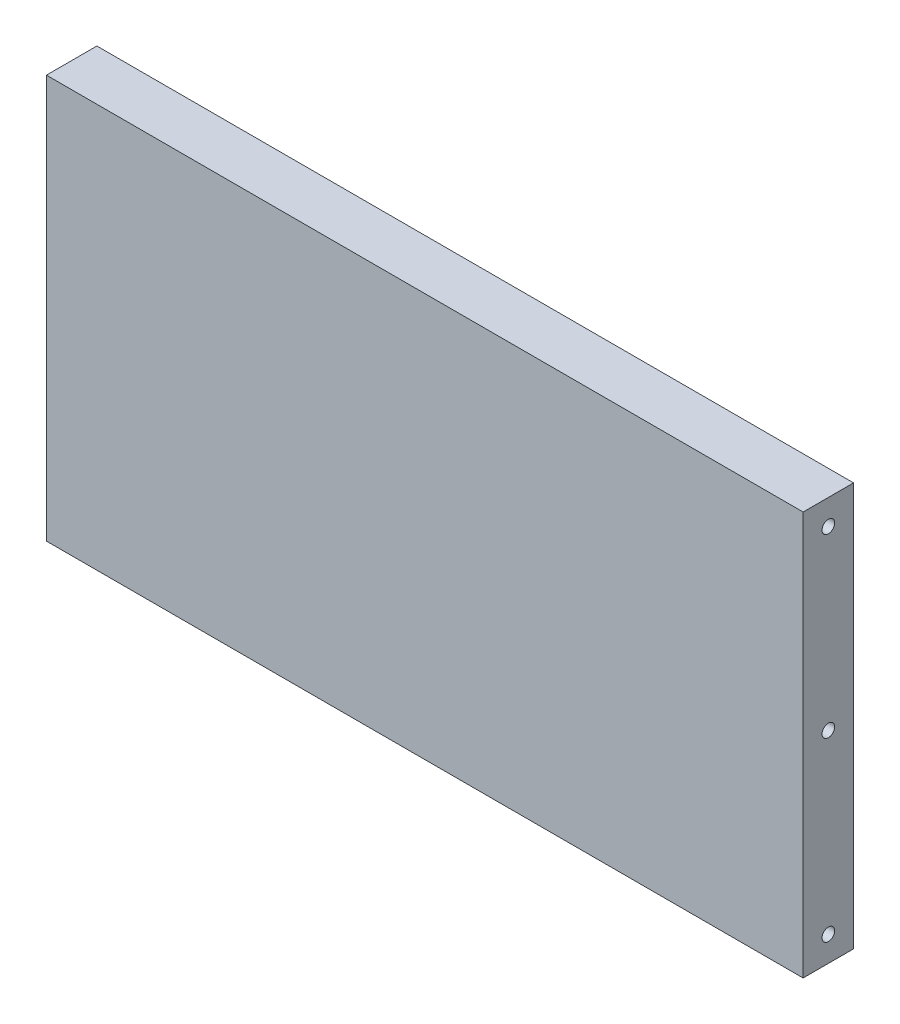
from build123d import *

# Parameters (mm, degrees)
SKIZZE1_W                       = 150
SKIZZE1_H                       = 80
AUFSATZ_LINEAR_AUSTRAGEN1_DEPTH = 10
SKIZZE2_R                       = 1.25
SCHNITT_LINEAR_AUSTRAGEN1_DEPTH = 5
SCHNITT_LINEAR_START            = -5
SKIZZE3_R                       = 1.25
SCHNITT_LINEAR_AUSTRAGEN2_DEPTH = 5


with BuildPart() as part:
    # Skizze1 → Aufsatz-Linear austragen1 (new body)
    with BuildSketch(Plane.XY):
        with Locations((9.444388014, 25.227272727)):
            Rectangle(SKIZZE1_W, SKIZZE1_H)
    extrude(amount=AUFSATZ_LINEAR_AUSTRAGEN1_DEPTH)

    # Skizze2 → Schnitt-Linear austragen1 (cut)
    with BuildSketch(Plane.ZY.offset(65.555611986)):
        with Locations((5, 60.227272727)):
            Circle(SKIZZE2_R)
        with Locations((5, 25.227272727)):
            Circle(SKIZZE2_R)
        with Locations((5, -9.772727273)):
            Circle(SKIZZE2_R)
    extrude(amount=-SCHNITT_LINEAR_AUSTRAGEN1_DEPTH, mode=Mode.SUBTRACT)

    # Skizze3 → Schnitt-Linear austragen2 (cut)
    with BuildSketch(Plane(origin=(84.444388014, 0, 0), x_dir=(0, 0, -1), z_dir=(1, 0, 0)).offset(SCHNITT_LINEAR_START)):
        with Locations((-5, 60.227272727)):
            Circle(SKIZZE3_R)
        with Locations((-5, 25.227272727)):
            Circle(SKIZZE3_R)
        with Locations((-5, -9.772727273)):
            Circle(SKIZZE3_R)
    extrude(amount=SCHNITT_LINEAR_AUSTRAGEN2_DEPTH, mode=Mode.SUBTRACT)


solid = part.part
